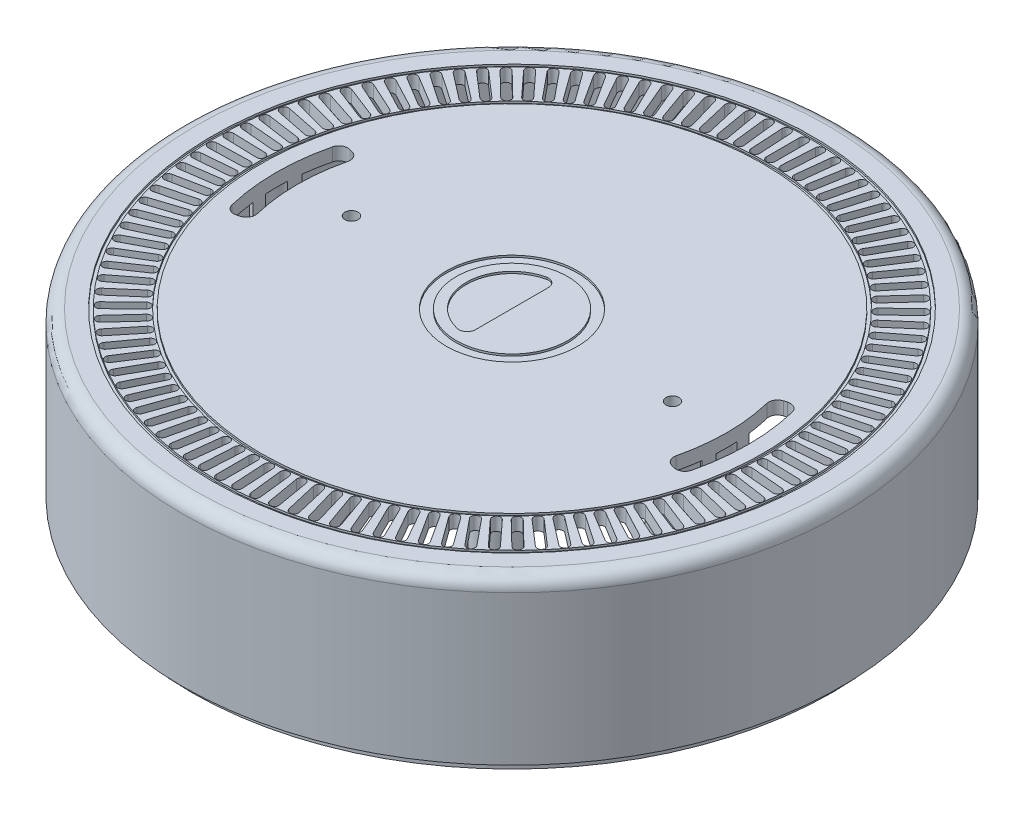
from build123d import *
from build123d.topology import SkipClean

# Parameters (mm, degrees)
SKETCH_1_R           = 50
EXTRUDE_1_DEPTH      = 4
SHELL_1_T            = -2
SKETCH_5_R           = 3
SKETCH_5_R_2         = 1.25
EXTRUDE_3_DEPTH      = 22.12
EXTRUDE_START        = -4
SKETCH_30_R          = 50.3
SKETCH_30_R_2        = 50
EXTRUDE_15_DEPTH     = 4
FILLET_3_R           = 2
CHAMFER_1_SIZE       = 0.3
EXTRUDE_START_2      = 28
SKETCH_38_R          = 50.3
SKETCH_38_R_2        = 48
EXTRUDE_21_DEPTH     = 28
SKETCH_44_R          = 50.3
SKETCH_44_R_2        = 48
CUT_EXTRUDE_6_DEPTH  = 5.7
CUT_EXTRUDE_7_DEPTH  = 2
SKETCH_35_R          = 45.7
SKETCH_35_R_2        = 45.2
SKETCH_35_R_3        = 38.8
SKETCH_35_R_4        = 38.3
CUT_EXTRUDE_9_DEPTH  = 0.3
SKETCH_46_R          = 1
CUT_EXTRUDE_10_DEPTH = 10
SKETCH_47_R          = 3
SKETCH_47_R_2        = 1
EXTRUDE_22_DEPTH     = 20.3
SKETCH_51_R          = 50.3
SKETCH_51_R_2        = 48.9
CUT_EXTRUDE_12_DEPTH = 1.5
SKETCH_57_R          = 1.25
EXTRUDE_23_DEPTH     = 13
SKETCH_34_R          = 10
SKETCH_34_R_2        = 8.490267481
CUT_EXTRUDE_14_DEPTH = 0.3
CUT_EXTRUDE_15_DEPTH = 3
EXTRUDE_24_DEPTH     = 10


with BuildPart() as part:
    # Эскиз1 → Бобышка-Вытянуть1 (new body)
    with BuildSketch(Plane(origin=(0, 0, 0), x_dir=(1, 0, 0), z_dir=(0, 1, 0))):
        with Locations(Location((0, 0, 0), (0, 0, 270))):
            Circle(SKETCH_1_R)
    extrude(amount=EXTRUDE_1_DEPTH)

    # Оболочка1
    shell_1_openings = [part.faces().sort_by_distance(p)[0] for p in [
        (0, 0, 0),
    ]]
    offset(amount=SHELL_1_T, openings=shell_1_openings, kind=Kind.INTERSECTION)

    # Эскиз5 → Бобышка-Вытянуть3 (add)
    # profile 1 of 4: a face of its own
    with BuildSketch(Plane.XZ.offset(-2)):
        with Locations(Location((-23.5, 26, 0), (0, 0, 90))):
            Circle(SKETCH_5_R)
        with Locations(Location((-23.5, 26, 0), (0, 0, 270))):
            Circle(SKETCH_5_R_2, mode=Mode.SUBTRACT)
    # profile 2 of 4: a face of its own
    with BuildSketch(Plane.XZ.offset(-2)):
        with Locations(Location((23.5, 26, 0), (0, 0, 90))):
            Circle(SKETCH_5_R)
        with Locations(Location((23.5, 26, 0), (0, 0, 270))):
            Circle(SKETCH_5_R_2, mode=Mode.SUBTRACT)
    # profile 3 of 4: a face of its own
    with BuildSketch(Plane.XZ.offset(-2)):
        with Locations(Location((23.5, -26, 0), (0, 0, 90))):
            Circle(SKETCH_5_R)
        with Locations(Location((23.5, -26, 0), (0, 0, 90))):
            Circle(SKETCH_5_R_2, mode=Mode.SUBTRACT)
    # profile 4 of 4: a face of its own
    with BuildSketch(Plane.XZ.offset(-2)):
        with Locations(Location((-23.5, -26, 0), (0, 0, 90))):
            Circle(SKETCH_5_R)
        with Locations(Location((-23.5, -26, 0), (0, 0, 90))):
            Circle(SKETCH_5_R_2, mode=Mode.SUBTRACT)
    extrude(amount=EXTRUDE_3_DEPTH)

    # Эскиз30 → Бобышка-Вытянуть15 (add)
    with BuildSketch(Plane(origin=(0, 4, 0), x_dir=(1, 0, 0), z_dir=(0, 1, 0)).offset(EXTRUDE_START)):
        with Locations(Location((0, 0, 0), (0, 0, 270))):
            Circle(SKETCH_30_R)
        Circle(SKETCH_30_R_2, mode=Mode.SUBTRACT)
    extrude(amount=EXTRUDE_15_DEPTH)

    # Скругление3
    fillet_3_edges = [part.edges().sort_by_distance(p)[0] for p in [
        (0, 4, -50.3),
    ]]
    fillet(fillet_3_edges, radius=FILLET_3_R)

    # Фаска1
    chamfer_1_edges = [part.edges().sort_by_distance(p)[0] for p in [
        (23.5, -20.12, -27.25),
        (23.5, -20.12, 27.25),
        (-23.5, -20.12, 27.25),
        (-23.5, -20.12, -27.25),
    ]]
    chamfer(chamfer_1_edges, length=CHAMFER_1_SIZE)

    # Эскиз38 → Бобышка-Вытянуть21 (add)
    with SkipClean():  # the faces are left unmerged after this step: merging them gives an invalid solid
        with BuildSketch(Plane.XZ.offset(EXTRUDE_START_2)):
            with Locations(Location((0, 0, 0), (0, 0, 90))):
                Circle(SKETCH_38_R)
            with Locations(Location((0, 0, 0), (0, 0, 270))):
                Circle(SKETCH_38_R_2, mode=Mode.SUBTRACT)
        extrude(amount=-EXTRUDE_21_DEPTH)

    # Эскиз44 → Вырез-Вытянуть6 (cut)
    with SkipClean():  # the faces are left unmerged after this step: merging them gives an invalid solid
        with BuildSketch(Plane.XZ.offset(28)):
            with Locations(Location((0, 0, 0), (0, 0, 90))):
                Circle(SKETCH_44_R)
            with Locations(Location((0, 0, 0), (0, 0, 270))):
                Circle(SKETCH_44_R_2, mode=Mode.SUBTRACT)
        extrude(amount=-CUT_EXTRUDE_6_DEPTH, mode=Mode.SUBTRACT)

    # Эскиз45 → Вырез-Вытянуть7 (cut)
    with SkipClean():  # the faces are left unmerged after this step: merging them gives an invalid solid
        with BuildSketch(Plane(origin=(0, 4, 0), x_dir=(1, 0, 0), z_dir=(0, 1, 0))):
            with BuildLine():
                Line((32.93809173, -8.535873533), (33.42119606, -8.665320948))
                ThreePointArc((33.42119606, -8.665320948), (34.459583784, -8.522270602), (35.082611767, -7.679330154))
                ThreePointArc((35.082611767, -7.679330154), (36, 0), (35.082611767, 7.679330154))
                ThreePointArc((35.082611767, 7.679330154), (34.459583784, 8.522270602), (33.42119606, 8.665320948))
                Line((33.42119606, 8.665320948), (32.93809173, 8.535873533))
                ThreePointArc((32.93809173, 8.535873533), (32.126682419, 7.921082261), (31.975363407, 6.914376775))
                ThreePointArc((31.975363407, 6.914376775), (32.8, 0), (31.975363407, -6.914376775))
                ThreePointArc((31.975363407, -6.914376775), (32.126682419, -7.921082261), (32.93809173, -8.535873533))
            make_face()
            with BuildLine():
                Line((-32.93809173, 8.535873533), (-33.42119606, 8.665320948))
                ThreePointArc((-33.42119606, 8.665320948), (-34.459583784, 8.522270602), (-35.082611767, 7.679330154))
                ThreePointArc((-35.082611767, 7.679330154), (-36, 0), (-35.082611767, -7.679330154))
                ThreePointArc((-35.082611767, -7.679330154), (-34.459583784, -8.522270602), (-33.42119606, -8.665320948))
                Line((-33.42119606, -8.665320948), (-32.93809173, -8.535873533))
                ThreePointArc((-32.93809173, -8.535873533), (-32.126682419, -7.921082261), (-31.975363407, -6.914376775))
                ThreePointArc((-31.975363407, -6.914376775), (-32.8, 0), (-31.975363407, 6.914376775))
                ThreePointArc((-31.975363407, 6.914376775), (-32.126682419, 7.921082261), (-32.93809173, 8.535873533))
            make_face()
        extrude(amount=-CUT_EXTRUDE_7_DEPTH, mode=Mode.SUBTRACT)

    # Эскиз35 → Вырез-Вытянуть9 (cut)
    # profile 1 of 2: a face of its own
    with SkipClean():  # the faces are left unmerged after this step: merging them gives an invalid solid
        with BuildSketch(Plane(origin=(0, 4, 0), x_dir=(1, 0, 0), z_dir=(0, 1, 0))):
            with Locations(Location((0, 0, 0), (0, 0, 270))):
                Circle(SKETCH_35_R)
            with Locations(Location((0, 0, 0), (0, 0, 270))):
                Circle(SKETCH_35_R_2, mode=Mode.SUBTRACT)
        # profile 2 of 2: a face of its own
        with BuildSketch(Plane(origin=(0, 4, 0), x_dir=(1, 0, 0), z_dir=(0, 1, 0))):
            with Locations(Location((0, 0, 0), (0, 0, 270))):
                Circle(SKETCH_35_R_3)
            with Locations(Location((0, 0, 0), (0, 0, 270))):
                Circle(SKETCH_35_R_4, mode=Mode.SUBTRACT)
        extrude(amount=-CUT_EXTRUDE_9_DEPTH, mode=Mode.SUBTRACT)

    # Эскиз46 → Вырез-Вытянуть10 (cut)
    with SkipClean():  # the faces are left unmerged after this step: merging them gives an invalid solid
        with BuildSketch(Plane(origin=(0, 4, 0), x_dir=(1, 0, 0), z_dir=(0, 1, 0))):
            with Locations(Location((24.5, 0, 0), (0, 0, 270))):
                Circle(SKETCH_46_R)
            with Locations(Location((-24.5, 0, 0), (0, 0, 270))):
                Circle(SKETCH_46_R)
        extrude(amount=-CUT_EXTRUDE_10_DEPTH, mode=Mode.SUBTRACT)

    # Эскиз47 → Бобышка-Вытянуть22 (add)
    # profile 1 of 2: a face of its own
    with SkipClean():  # the faces are left unmerged after this step: merging them gives an invalid solid
        with BuildSketch(Plane.XZ.offset(-2)):
            with Locations(Location((-24.5, 0, 0), (0, 0, 90))):
                Circle(SKETCH_47_R)
            with Locations(Location((-24.5, 0, 0), (0, 0, 270))):
                Circle(SKETCH_47_R_2, mode=Mode.SUBTRACT)
        # profile 2 of 2: a face of its own
        with BuildSketch(Plane.XZ.offset(-2)):
            with Locations(Location((24.5, 0, 0), (0, 0, 90))):
                Circle(SKETCH_47_R)
            with Locations(Location((24.5, 0, 0), (0, 0, 90))):
                Circle(SKETCH_47_R_2, mode=Mode.SUBTRACT)
        extrude(amount=EXTRUDE_22_DEPTH)

    # Эскиз51 → Вырез-Вытянуть12 (cut)
    with SkipClean():  # the faces are left unmerged after this step: merging them gives an invalid solid
        with BuildSketch(Plane.XZ.offset(22.3)):
            with Locations(Location((0, 0, 0), (0, 0, 90))):
                Circle(SKETCH_51_R)
            with Locations(Location((0, 0, 0), (0, 0, 270))):
                Circle(SKETCH_51_R_2, mode=Mode.SUBTRACT)
        extrude(amount=-CUT_EXTRUDE_12_DEPTH, mode=Mode.SUBTRACT)

    # Эскиз57 → Бобышка-Вытянуть23 (add)
    with SkipClean():  # the faces are left unmerged after this step: merging them gives an invalid solid
        with BuildSketch(Plane.XZ.offset(-2)):
            with Locations(Location((-23.5, 26, 0), (0, 0, 270))):
                Circle(SKETCH_57_R)
            with Locations(Location((-23.5, -26, 0), (0, 0, 90))):
                Circle(SKETCH_57_R)
            with Locations(Location((23.5, -26, 0), (0, 0, 90))):
                Circle(SKETCH_57_R)
            with Locations(Location((23.5, 26, 0), (0, 0, 270))):
                Circle(SKETCH_57_R)
        extrude(amount=EXTRUDE_23_DEPTH)

    # Эскиз34 → Вырез-Вытянуть14 (cut)
    # profile 1 of 2: a face of its own
    with SkipClean():  # the faces are left unmerged after this step: merging them gives an invalid solid
        with BuildSketch(Plane(origin=(0, 4, 0), x_dir=(1, 0, 0), z_dir=(0, 1, 0))):
            with Locations(Location((0, 0, 0), (0, 0, 270))):
                Circle(SKETCH_34_R)
            with Locations(Location((0, 0, 0), (0, 0, 270))):
                Circle(SKETCH_34_R_2, mode=Mode.SUBTRACT)
        # profile 2 of 2: a face of its own
        with BuildSketch(Plane(origin=(0, 4, 0), x_dir=(1, 0, 0), z_dir=(0, 1, 0))):
            with BuildLine():
                ThreePointArc((0, -5.565646409), (-0.474742908, -6.552289655), (-1.5419684, -6.796984316))
                ThreePointArc((-1.5419684, -6.796984316), (-6.969696, 0), (-1.5419684, 6.796984316))
                ThreePointArc((-1.5419684, 6.796984316), (-0.474742908, 6.552289655), (0, 5.565646409))
                Line((0, 5.565646409), (0, -5.565646409))
            make_face()
        extrude(amount=-CUT_EXTRUDE_14_DEPTH, mode=Mode.SUBTRACT)

    # Эскиз60 → Вырез-Вытянуть15 (cut)
    with SkipClean():  # the faces are left unmerged after this step: merging them gives an invalid solid
        with BuildSketch(Plane(origin=(0, 4, 0), x_dir=(1, 0, 0), z_dir=(0, 1, 0))):
            with BuildLine():
                Line((0.65, 44.480332068), (0.65, 39.480332068))
                ThreePointArc((0.65, 39.480332068), (0, 38.830332068), (-0.65, 39.480332068))
                Line((-0.65, 39.480332068), (-0.65, 44.480332068))
                ThreePointArc((-0.65, 44.480332068), (0, 45.130332068), (0.65, 44.480332068))
            make_face()
            with BuildLine():
                Line((3.188269182, 44.370681542), (2.902825128, 39.378836022))
                ThreePointArc((2.902825128, 39.378836022), (2.216777483, 38.767003831), (1.604945293, 39.453051476))
                Line((1.604945293, 39.453051476), (1.890389347, 44.444896996))
                ThreePointArc((1.890389347, 44.444896996), (2.576436992, 45.056729186), (3.188269182, 44.370681542))
            make_face()
            with BuildLine():
                Line((5.716138893, 44.116303075), (5.146181843, 39.148894398))
                ThreePointArc((5.146181843, 39.148894398), (4.426324299, 38.577225687), (3.854655587, 39.297083231))
                Line((3.854655587, 39.297083231), (4.424612637, 44.264491908))
                ThreePointArc((4.424612637, 44.264491908), (5.144470181, 44.836160619), (5.716138893, 44.116303075))
            make_face()
            with BuildLine():
                Line((8.225363746, 43.718026397), (7.372752783, 38.791257218))
                ThreePointArc((7.372752783, 38.791257218), (6.621433365, 38.26161665), (6.091792797, 39.012936069))
                Line((6.091792797, 39.012936069), (6.94440376, 43.939705248))
                ThreePointArc((6.94440376, 43.939705248), (7.695723178, 44.469345816), (8.225363746, 43.718026397))
            make_face()
            with BuildLine():
                Line((10.707759173, 43.177150605), (9.575275336, 38.30709102))
                ThreePointArc((9.575275336, 38.30709102), (8.794944691, 37.821206173), (8.309059844, 38.601536817))
                Line((8.309059844, 38.601536817), (9.441543681, 43.471596402))
                ThreePointArc((9.441543681, 43.471596402), (10.221874326, 43.957481249), (10.707759173, 43.177150605))
            make_face()
            with BuildLine():
                Line((13.155228115, 42.495439921), (11.746565331, 37.697975053))
                ThreePointArc((11.746565331, 37.697975053), (10.939768736, 37.257430782), (10.499224465, 38.064227377))
                Line((10.499224465, 38.064227377), (11.90788725, 42.861692245))
                ThreePointArc((11.90788725, 42.861692245), (12.714683844, 43.302236516), (13.155228115, 42.495439921))
            make_face()
            with BuildLine():
                Line((15.559787438, 41.675117945), (13.879540472, 36.965896127))
                ThreePointArc((13.879540472, 36.965896127), (13.04890953, 36.572129396), (12.655142799, 37.402760338))
                Line((12.655142799, 37.402760338), (14.335389765, 42.111982156))
                ThreePointArc((14.335389765, 42.111982156), (15.166020707, 42.505748887), (15.559787438, 41.675117945))
            make_face()
            with BuildLine():
                Line((17.913593967, 40.718860397), (15.967243436, 36.113242131))
                ThreePointArc((15.967243436, 36.113242131), (15.115487492, 35.767537326), (14.769782687, 36.619293269))
                Line((14.769782687, 36.619293269), (16.716133218, 41.224911535))
                ThreePointArc((16.716133218, 41.224911535), (17.567889162, 41.57061634), (17.913593967, 40.718860397))
            make_face()
            with BuildLine():
                Line((20.208970077, 39.629786389), (18.002864571, 35.142794246))
                ThreePointArc((18.002864571, 35.142794246), (17.132761876, 34.846278983), (16.836246614, 35.716381677))
                Line((16.836246614, 35.716381677), (19.04235212, 40.203373821))
                ThreePointArc((19.04235212, 40.203373821), (19.912454814, 40.499889084), (20.208970077, 39.629786389))
            make_face()
            with BuildLine():
                Line((22.438428727, 38.411448256), (19.979764104, 34.05771787))
                ThreePointArc((19.979764104, 34.05771787), (19.094152753, 33.811359321), (18.847794203, 34.696970672))
                Line((18.847794203, 34.696970672), (21.306458827, 39.050701058))
                ThreePointArc((21.306458827, 39.050701058), (22.192070178, 39.297059607), (22.438428727, 38.411448256))
            make_face()
            with BuildLine():
                Line((24.594697886, 37.067819962), (21.891493799, 32.861552298))
                ThreePointArc((21.891493799, 32.861552298), (20.993262471, 32.666154033), (20.797864206, 33.564385361))
                Line((20.797864206, 33.564385361), (23.501068293, 37.770653025))
                ThreePointArc((23.501068293, 37.770653025), (24.399299621, 37.96605129), (24.594697886, 37.067819962))
            make_face()
            with BuildLine():
                Line((26.670744253, 35.603284144), (23.731817991, 31.558199172))
                ThreePointArc((23.731817991, 31.558199172), (22.823896531, 31.41439854), (22.680095899, 32.32232))
                Line((22.680095899, 32.32232), (25.61902216, 36.367404972))
                ThreePointArc((25.61902216, 36.367404972), (26.52694362, 36.511205604), (26.670744253, 35.603284144))
            make_face()
            with BuildLine():
                Line((28.659796195, 34.022617814), (25.494733926, 30.15190976))
                ThreePointArc((25.494733926, 30.15190976), (24.580083784, 30.060175808), (24.488349832, 30.97482595))
                Line((24.488349832, 30.97482595), (27.653412101, 34.845534004))
                ThreePointArc((27.653412101, 34.845534004), (28.568062243, 34.937267955), (28.659796195, 34.022617814))
            make_face()
            with BuildLine():
                Line((30.55536584, 32.330976775), (27.174491338, 28.647271086))
                ThreePointArc((27.174491338, 28.647271086), (26.256095913, 28.607903032), (26.216727859, 29.526298456))
                Line((26.216727859, 29.526298456), (29.59760236, 33.210004146))
                ThreePointArc((29.59760236, 33.210004146), (30.515997785, 33.2493722), (30.55536584, 32.330976775))
            make_face()
            with BuildLine():
                Line((32.351270232, 30.533878811), (28.765611208, 27.049190968))
                ThreePointArc((28.765611208, 27.049190968), (27.846466115, 27.062317221), (27.859592368, 27.981462314))
                Line((27.859592368, 27.981462314), (31.445251392, 31.466150157))
                ThreePointArc((31.445251392, 31.466150157), (32.364396485, 31.453023904), (32.351270232, 30.533878811))
            make_face()
            with BuildLine():
                Line((34.041651504, 28.637185681), (30.262903632, 25.362882011))
                ThreePointArc((30.262903632, 25.362882011), (29.346006932, 25.428459757), (29.411584678, 26.345356457))
                Line((29.411584678, 26.345356457), (33.19033255, 29.619660127))
                ThreePointArc((33.19033255, 29.619660127), (34.107229251, 29.554082381), (34.041651504, 28.637185681))
            make_face()
            with BuildLine():
                Line((35.620995985, 26.647084003), (31.661484756, 23.593844605))
                ThreePointArc((31.661484756, 23.593844605), (30.749827174, 23.711659943), (30.867642512, 24.623317524))
                Line((30.867642512, 24.623317524), (34.827153742, 27.676556922))
                ThreePointArc((34.827153742, 27.676556922), (35.738811324, 27.558741584), (35.620995985, 26.647084003))
            make_face()
            with BuildLine():
                Line((37.084152182, 24.570065075), (32.956792697, 21.747848981))
                ThreePointArc((32.956792697, 21.747848981), (32.053347872, 21.917517622), (32.223016512, 22.820962447))
                Line((32.223016512, 22.820962447), (36.350375997, 25.643178542))
                ThreePointArc((36.350375997, 25.643178542), (37.253820822, 25.473509901), (37.084152182, 24.570065075))
            make_face()
            with BuildLine():
                Line((38.426347581, 22.412903703), (34.14460243, 19.830916395))
                ThreePointArc((34.14460243, 19.830916395), (33.25231721, 20.051884914), (33.47328573, 20.944170134))
                Line((33.47328573, 20.944170134), (37.755030881, 23.526157442))
                ThreePointArc((37.755030881, 23.526157442), (38.647316101, 23.305188923), (38.426347581, 22.412903703))
            make_face()
            with BuildLine():
                Line((39.643204222, 20.182636097), (35.221039567, 17.849299481))
                ThreePointArc((35.221039567, 17.849299481), (34.342824402, 18.120847126), (34.614372047, 18.999062291))
                Line((34.614372047, 18.999062291), (39.036536702, 21.332398907))
                ThreePointArc((39.036536702, 21.332398907), (39.914751867, 21.060851262), (39.643204222, 20.182636097))
            make_face()
            with BuildLine():
                Line((40.730752971, 17.886536927), (36.182592994, 15.809461862))
                ThreePointArc((36.182592994, 15.809461862), (35.321312439, 16.130702901), (35.642553477, 16.991983456))
                Line((35.642553477, 16.991983456), (40.190713454, 19.069058521))
                ThreePointArc((40.190713454, 19.069058521), (41.05199401, 18.747817483), (40.730752971, 17.886536927))
            make_face()
            with BuildLine():
                Line((41.68544647, 15.532095592), (37.026126324, 13.718057065))
                ThreePointArc((37.026126324, 13.718057065), (36.184589696, 14.087943675), (36.554476307, 14.929480303))
                Line((36.554476307, 14.929480303), (41.213796453, 16.74351883))
                ThreePointArc((41.213796453, 16.74351883), (42.05533308, 16.373632219), (41.68544647, 15.532095592))
            make_face()
            with BuildLine():
                Line((42.504170706, 13.126991789), (37.748888125, 11.581906817))
                ThreePointArc((37.748888125, 11.581906817), (36.929840343, 11.999232506), (37.347166032, 12.818280288))
                Line((37.347166032, 12.818280288), (42.102448613, 14.36336526))
                ThreePointArc((42.102448613, 14.36336526), (42.921496395, 13.946039571), (42.504170706, 13.126991789))
            make_face()
            with BuildLine():
                Line((43.184255172, 10.679070467), (38.348520899, 9.407978796))
                ThreePointArc((38.348520899, 9.407978796), (37.554633526, 9.871382334), (38.018037065, 10.665269707))
                Line((38.018037065, 10.665269707), (42.853771338, 11.936361378))
                ThreePointArc((42.853771338, 11.936361378), (43.647658711, 11.47295784), (43.184255172, 10.679070467))
            make_face()
            with BuildLine():
                Line((43.723481574, 8.196316237), (38.823068769, 7.203363904))
                ThreePointArc((38.823068769, 7.203363904), (38.056931301, 7.711333765), (38.564901162, 8.477471233))
                Line((38.564901162, 8.477471233), (43.465313968, 9.470423567))
                ThreePointArc((43.465313968, 9.470423567), (44.231451436, 8.962453705), (43.723481574, 8.196316237))
            make_face()
            with BuildLine():
                Line((44.120091067, 5.686827327), (39.170983858, 4.975253136))
                ThreePointArc((39.170983858, 4.975253136), (38.435095276, 5.526132428), (38.985974568, 6.26202101))
                Line((38.985974568, 6.26202101), (43.935081778, 6.973595202))
                ThreePointArc((43.935081778, 6.973595202), (44.67097036, 6.422715909), (44.120091067, 5.686827327))
            make_face()
            with BuildLine():
                Line((44.372789994, 3.158789169), (39.391131339, 2.730914126))
                ThreePointArc((39.391131339, 2.730914126), (38.687891959, 3.322905996), (39.279883828, 4.026145376))
                Line((39.279883828, 4.026145376), (44.261542483, 4.454020419))
                ThreePointArc((44.261542483, 4.454020419), (44.964781863, 3.862028549), (44.372789994, 3.158789169))
            make_face()
            with BuildLine():
                Line((44.480754102, 0.620447697), (39.482793138, 0.477667443))
                ThreePointArc((39.482793138, 0.477667443), (38.81449678, 1.108840935), (39.445670272, 1.777137293))
                Line((39.445670272, 1.777137293), (44.443631236, 1.919917547))
                ThreePointArc((44.443631236, 1.919917547), (45.111927594, 1.288744055), (44.480754102, 0.620447697))
            make_face()
            with BuildLine():
                Line((44.443631236, -1.919917547), (39.445670272, -1.777137293))
                ThreePointArc((39.445670272, -1.777137293), (38.81449678, -1.108840935), (39.482793138, -0.477667443))
                Line((39.482793138, -0.477667443), (44.480754102, -0.620447697))
                ThreePointArc((44.480754102, -0.620447697), (45.111927594, -1.288744055), (44.443631236, -1.919917547))
            make_face()
            with BuildLine():
                Line((44.261542483, -4.454020419), (39.279883828, -4.026145376))
                ThreePointArc((39.279883828, -4.026145376), (38.687891959, -3.322905996), (39.391131339, -2.730914126))
                Line((39.391131339, -2.730914126), (44.372789994, -3.158789169))
                ThreePointArc((44.372789994, -3.158789169), (44.964781863, -3.862028549), (44.261542483, -4.454020419))
            make_face()
            with BuildLine():
                Line((43.935081778, -6.973595202), (38.985974568, -6.26202101))
                ThreePointArc((38.985974568, -6.26202101), (38.435095276, -5.526132428), (39.170983858, -4.975253136))
                Line((39.170983858, -4.975253136), (44.120091067, -5.686827327))
                ThreePointArc((44.120091067, -5.686827327), (44.67097036, -6.422715909), (43.935081778, -6.973595202))
            make_face()
            with BuildLine():
                Line((43.465313968, -9.470423567), (38.564901162, -8.477471233))
                ThreePointArc((38.564901162, -8.477471233), (38.056931301, -7.711333765), (38.823068769, -7.203363904))
                Line((38.823068769, -7.203363904), (43.723481574, -8.196316237))
                ThreePointArc((43.723481574, -8.196316237), (44.231451436, -8.962453705), (43.465313968, -9.470423567))
            make_face()
            with BuildLine():
                Line((42.853771338, -11.936361378), (38.018037065, -10.665269707))
                ThreePointArc((38.018037065, -10.665269707), (37.554633526, -9.871382334), (38.348520899, -9.407978796))
                Line((38.348520899, -9.407978796), (43.184255172, -10.679070467))
                ThreePointArc((43.184255172, -10.679070467), (43.647658711, -11.47295784), (42.853771338, -11.936361378))
            make_face()
            with BuildLine():
                Line((42.102448613, -14.36336526), (37.347166032, -12.818280288))
                ThreePointArc((37.347166032, -12.818280288), (36.929840343, -11.999232506), (37.748888125, -11.581906817))
                Line((37.748888125, -11.581906817), (42.504170706, -13.126991789))
                ThreePointArc((42.504170706, -13.126991789), (42.921496395, -13.946039571), (42.102448613, -14.36336526))
            make_face()
            with BuildLine():
                Line((41.213796453, -16.74351883), (36.554476307, -14.929480303))
                ThreePointArc((36.554476307, -14.929480303), (36.184589696, -14.087943675), (37.026126324, -13.718057065))
                Line((37.026126324, -13.718057065), (41.68544647, -15.532095592))
                ThreePointArc((41.68544647, -15.532095592), (42.05533308, -16.373632219), (41.213796453, -16.74351883))
            make_face()
            with BuildLine():
                Line((40.190713454, -19.069058521), (35.642553477, -16.991983456))
                ThreePointArc((35.642553477, -16.991983456), (35.321312439, -16.130702901), (36.182592994, -15.809461862))
                Line((36.182592994, -15.809461862), (40.730752971, -17.886536927))
                ThreePointArc((40.730752971, -17.886536927), (41.05199401, -18.747817483), (40.190713454, -19.069058521))
            make_face()
            with BuildLine():
                Line((39.036536702, -21.332398907), (34.614372047, -18.999062291))
                ThreePointArc((34.614372047, -18.999062291), (34.342824402, -18.120847126), (35.221039567, -17.849299481))
                Line((35.221039567, -17.849299481), (39.643204222, -20.182636097))
                ThreePointArc((39.643204222, -20.182636097), (39.914751867, -21.060851262), (39.036536702, -21.332398907))
            make_face()
            with BuildLine():
                Line((37.755030881, -23.526157442), (33.47328573, -20.944170134))
                ThreePointArc((33.47328573, -20.944170134), (33.25231721, -20.051884914), (34.14460243, -19.830916395))
                Line((34.14460243, -19.830916395), (38.426347581, -22.412903703))
                ThreePointArc((38.426347581, -22.412903703), (38.647316101, -23.305188923), (37.755030881, -23.526157442))
            make_face()
            with BuildLine():
                Line((36.350375997, -25.643178542), (32.223016512, -22.820962447))
                ThreePointArc((32.223016512, -22.820962447), (32.053347872, -21.917517622), (32.956792697, -21.747848981))
                Line((32.956792697, -21.747848981), (37.084152182, -24.570065075))
                ThreePointArc((37.084152182, -24.570065075), (37.253820822, -25.473509901), (36.350375997, -25.643178542))
            make_face()
            with BuildLine():
                Line((34.827153742, -27.676556922), (30.867642512, -24.623317524))
                ThreePointArc((30.867642512, -24.623317524), (30.749827174, -23.711659943), (31.661484756, -23.593844605))
                Line((31.661484756, -23.593844605), (35.620995985, -26.647084003))
                ThreePointArc((35.620995985, -26.647084003), (35.738811324, -27.558741584), (34.827153742, -27.676556922))
            make_face()
            with BuildLine():
                Line((33.19033255, -29.619660127), (29.411584678, -26.345356457))
                ThreePointArc((29.411584678, -26.345356457), (29.346006932, -25.428459757), (30.262903632, -25.362882011))
                Line((30.262903632, -25.362882011), (34.041651504, -28.637185681))
                ThreePointArc((34.041651504, -28.637185681), (34.107229251, -29.554082381), (33.19033255, -29.619660127))
            make_face()
            with BuildLine():
                Line((31.445251392, -31.466150157), (27.859592368, -27.981462314))
                ThreePointArc((27.859592368, -27.981462314), (27.846466115, -27.062317221), (28.765611208, -27.049190968))
                Line((28.765611208, -27.049190968), (32.351270232, -30.533878811))
                ThreePointArc((32.351270232, -30.533878811), (32.364396485, -31.453023904), (31.445251392, -31.466150157))
            make_face()
            with BuildLine():
                Line((29.59760236, -33.210004146), (26.216727859, -29.526298456))
                ThreePointArc((26.216727859, -29.526298456), (26.256095913, -28.607903032), (27.174491338, -28.647271086))
                Line((27.174491338, -28.647271086), (30.55536584, -32.330976775))
                ThreePointArc((30.55536584, -32.330976775), (30.515997785, -33.2493722), (29.59760236, -33.210004146))
            make_face()
            with BuildLine():
                Line((27.653412101, -34.845534004), (24.488349832, -30.97482595))
                ThreePointArc((24.488349832, -30.97482595), (24.580083784, -30.060175808), (25.494733926, -30.15190976))
                Line((25.494733926, -30.15190976), (28.659796195, -34.022617814))
                ThreePointArc((28.659796195, -34.022617814), (28.568062243, -34.937267955), (27.653412101, -34.845534004))
            make_face()
            with BuildLine():
                Line((25.61902216, -36.367404972), (22.680095899, -32.32232))
                ThreePointArc((22.680095899, -32.32232), (22.823896531, -31.41439854), (23.731817991, -31.558199172))
                Line((23.731817991, -31.558199172), (26.670744253, -35.603284144))
                ThreePointArc((26.670744253, -35.603284144), (26.52694362, -36.511205604), (25.61902216, -36.367404972))
            make_face()
            with BuildLine():
                Line((23.501068293, -37.770653025), (20.797864206, -33.564385361))
                ThreePointArc((20.797864206, -33.564385361), (20.993262471, -32.666154033), (21.891493799, -32.861552298))
                Line((21.891493799, -32.861552298), (24.594697886, -37.067819962))
                ThreePointArc((24.594697886, -37.067819962), (24.399299621, -37.96605129), (23.501068293, -37.770653025))
            make_face()
            with BuildLine():
                Line((21.306458827, -39.050701058), (18.847794203, -34.696970672))
                ThreePointArc((18.847794203, -34.696970672), (19.094152753, -33.811359321), (19.979764104, -34.05771787))
                Line((19.979764104, -34.05771787), (22.438428727, -38.411448256))
                ThreePointArc((22.438428727, -38.411448256), (22.192070178, -39.297059607), (21.306458827, -39.050701058))
            make_face()
            with BuildLine():
                Line((19.04235212, -40.203373821), (16.836246614, -35.716381677))
                ThreePointArc((16.836246614, -35.716381677), (17.132761876, -34.846278983), (18.002864571, -35.142794246))
                Line((18.002864571, -35.142794246), (20.208970077, -39.629786389))
                ThreePointArc((20.208970077, -39.629786389), (19.912454814, -40.499889084), (19.04235212, -40.203373821))
            make_face()
            with BuildLine():
                Line((16.716133218, -41.224911535), (14.769782687, -36.619293269))
                ThreePointArc((14.769782687, -36.619293269), (15.115487492, -35.767537326), (15.967243436, -36.113242131))
                Line((15.967243436, -36.113242131), (17.913593967, -40.718860397))
                ThreePointArc((17.913593967, -40.718860397), (17.567889162, -41.57061634), (16.716133218, -41.224911535))
            make_face()
            with BuildLine():
                Line((14.335389765, -42.111982156), (12.655142799, -37.402760338))
                ThreePointArc((12.655142799, -37.402760338), (13.04890953, -36.572129396), (13.879540472, -36.965896127))
                Line((13.879540472, -36.965896127), (15.559787438, -41.675117945))
                ThreePointArc((15.559787438, -41.675117945), (15.166020707, -42.505748887), (14.335389765, -42.111982156))
            make_face()
            with BuildLine():
                Line((11.90788725, -42.861692245), (10.499224465, -38.064227377))
                ThreePointArc((10.499224465, -38.064227377), (10.939768736, -37.257430782), (11.746565331, -37.697975053))
                Line((11.746565331, -37.697975053), (13.155228115, -42.495439921))
                ThreePointArc((13.155228115, -42.495439921), (12.714683844, -43.302236516), (11.90788725, -42.861692245))
            make_face()
            with BuildLine():
                Line((9.441543681, -43.471596402), (8.309059844, -38.601536817))
                ThreePointArc((8.309059844, -38.601536817), (8.794944691, -37.821206173), (9.575275336, -38.30709102))
                Line((9.575275336, -38.30709102), (10.707759173, -43.177150605))
                ThreePointArc((10.707759173, -43.177150605), (10.221874326, -43.957481249), (9.441543681, -43.471596402))
            make_face()
            with BuildLine():
                Line((6.94440376, -43.939705248), (6.091792797, -39.012936069))
                ThreePointArc((6.091792797, -39.012936069), (6.621433365, -38.26161665), (7.372752783, -38.791257218))
                Line((7.372752783, -38.791257218), (8.225363746, -43.718026397))
                ThreePointArc((8.225363746, -43.718026397), (7.695723178, -44.469345816), (6.94440376, -43.939705248))
            make_face()
            with BuildLine():
                Line((4.424612637, -44.264491908), (3.854655587, -39.297083231))
                ThreePointArc((3.854655587, -39.297083231), (4.426324299, -38.577225687), (5.146181843, -39.148894398))
                Line((5.146181843, -39.148894398), (5.716138893, -44.116303075))
                ThreePointArc((5.716138893, -44.116303075), (5.144470181, -44.836160619), (4.424612637, -44.264491908))
            make_face()
            with BuildLine():
                Line((1.890389347, -44.444896996), (1.604945293, -39.453051476))
                ThreePointArc((1.604945293, -39.453051476), (2.216777483, -38.767003831), (2.902825128, -39.378836022))
                Line((2.902825128, -39.378836022), (3.188269182, -44.370681542))
                ThreePointArc((3.188269182, -44.370681542), (2.576436992, -45.056729186), (1.890389347, -44.444896996))
            make_face()
            with BuildLine():
                Line((-0.65, -44.480332068), (-0.65, -39.480332068))
                ThreePointArc((-0.65, -39.480332068), (0, -38.830332068), (0.65, -39.480332068))
                Line((0.65, -39.480332068), (0.65, -44.480332068))
                ThreePointArc((0.65, -44.480332068), (0, -45.130332068), (-0.65, -44.480332068))
            make_face()
            with BuildLine():
                Line((-3.188269182, -44.370681542), (-2.902825128, -39.378836022))
                ThreePointArc((-2.902825128, -39.378836022), (-2.216777483, -38.767003831), (-1.604945293, -39.453051476))
                Line((-1.604945293, -39.453051476), (-1.890389347, -44.444896996))
                ThreePointArc((-1.890389347, -44.444896996), (-2.576436992, -45.056729186), (-3.188269182, -44.370681542))
            make_face()
            with BuildLine():
                Line((-5.716138893, -44.116303075), (-5.146181843, -39.148894398))
                ThreePointArc((-5.146181843, -39.148894398), (-4.426324299, -38.577225687), (-3.854655587, -39.297083231))
                Line((-3.854655587, -39.297083231), (-4.424612637, -44.264491908))
                ThreePointArc((-4.424612637, -44.264491908), (-5.144470181, -44.836160619), (-5.716138893, -44.116303075))
            make_face()
            with BuildLine():
                Line((-8.225363746, -43.718026397), (-7.372752783, -38.791257218))
                ThreePointArc((-7.372752783, -38.791257218), (-6.621433365, -38.26161665), (-6.091792797, -39.012936069))
                Line((-6.091792797, -39.012936069), (-6.94440376, -43.939705248))
                ThreePointArc((-6.94440376, -43.939705248), (-7.695723178, -44.469345816), (-8.225363746, -43.718026397))
            make_face()
            with BuildLine():
                Line((-10.707759173, -43.177150605), (-9.575275336, -38.30709102))
                ThreePointArc((-9.575275336, -38.30709102), (-8.794944691, -37.821206173), (-8.309059844, -38.601536817))
                Line((-8.309059844, -38.601536817), (-9.441543681, -43.471596402))
                ThreePointArc((-9.441543681, -43.471596402), (-10.221874326, -43.957481249), (-10.707759173, -43.177150605))
            make_face()
            with BuildLine():
                Line((-13.155228115, -42.495439921), (-11.746565331, -37.697975053))
                ThreePointArc((-11.746565331, -37.697975053), (-10.939768736, -37.257430782), (-10.499224465, -38.064227377))
                Line((-10.499224465, -38.064227377), (-11.90788725, -42.861692245))
                ThreePointArc((-11.90788725, -42.861692245), (-12.714683844, -43.302236516), (-13.155228115, -42.495439921))
            make_face()
            with BuildLine():
                Line((-15.559787438, -41.675117945), (-13.879540472, -36.965896127))
                ThreePointArc((-13.879540472, -36.965896127), (-13.04890953, -36.572129396), (-12.655142799, -37.402760338))
                Line((-12.655142799, -37.402760338), (-14.335389765, -42.111982156))
                ThreePointArc((-14.335389765, -42.111982156), (-15.166020707, -42.505748887), (-15.559787438, -41.675117945))
            make_face()
            with BuildLine():
                Line((-17.913593967, -40.718860397), (-15.967243436, -36.113242131))
                ThreePointArc((-15.967243436, -36.113242131), (-15.115487492, -35.767537326), (-14.769782687, -36.619293269))
                Line((-14.769782687, -36.619293269), (-16.716133218, -41.224911535))
                ThreePointArc((-16.716133218, -41.224911535), (-17.567889162, -41.57061634), (-17.913593967, -40.718860397))
            make_face()
            with BuildLine():
                Line((-20.208970077, -39.629786389), (-18.002864571, -35.142794246))
                ThreePointArc((-18.002864571, -35.142794246), (-17.132761876, -34.846278983), (-16.836246614, -35.716381677))
                Line((-16.836246614, -35.716381677), (-19.04235212, -40.203373821))
                ThreePointArc((-19.04235212, -40.203373821), (-19.912454814, -40.499889084), (-20.208970077, -39.629786389))
            make_face()
            with BuildLine():
                Line((-22.438428727, -38.411448256), (-19.979764104, -34.05771787))
                ThreePointArc((-19.979764104, -34.05771787), (-19.094152753, -33.811359321), (-18.847794203, -34.696970672))
                Line((-18.847794203, -34.696970672), (-21.306458827, -39.050701058))
                ThreePointArc((-21.306458827, -39.050701058), (-22.192070178, -39.297059607), (-22.438428727, -38.411448256))
            make_face()
            with BuildLine():
                Line((-24.594697886, -37.067819962), (-21.891493799, -32.861552298))
                ThreePointArc((-21.891493799, -32.861552298), (-20.993262471, -32.666154033), (-20.797864206, -33.564385361))
                Line((-20.797864206, -33.564385361), (-23.501068293, -37.770653025))
                ThreePointArc((-23.501068293, -37.770653025), (-24.399299621, -37.96605129), (-24.594697886, -37.067819962))
            make_face()
            with BuildLine():
                Line((-26.670744253, -35.603284144), (-23.731817991, -31.558199172))
                ThreePointArc((-23.731817991, -31.558199172), (-22.823896531, -31.41439854), (-22.680095899, -32.32232))
                Line((-22.680095899, -32.32232), (-25.61902216, -36.367404972))
                ThreePointArc((-25.61902216, -36.367404972), (-26.52694362, -36.511205604), (-26.670744253, -35.603284144))
            make_face()
            with BuildLine():
                Line((-28.659796195, -34.022617814), (-25.494733926, -30.15190976))
                ThreePointArc((-25.494733926, -30.15190976), (-24.580083784, -30.060175808), (-24.488349832, -30.97482595))
                Line((-24.488349832, -30.97482595), (-27.653412101, -34.845534004))
                ThreePointArc((-27.653412101, -34.845534004), (-28.568062243, -34.937267955), (-28.659796195, -34.022617814))
            make_face()
            with BuildLine():
                Line((-30.55536584, -32.330976775), (-27.174491338, -28.647271086))
                ThreePointArc((-27.174491338, -28.647271086), (-26.256095913, -28.607903032), (-26.216727859, -29.526298456))
                Line((-26.216727859, -29.526298456), (-29.59760236, -33.210004146))
                ThreePointArc((-29.59760236, -33.210004146), (-30.515997785, -33.2493722), (-30.55536584, -32.330976775))
            make_face()
            with BuildLine():
                Line((-32.351270232, -30.533878811), (-28.765611208, -27.049190968))
                ThreePointArc((-28.765611208, -27.049190968), (-27.846466115, -27.062317221), (-27.859592368, -27.981462314))
                Line((-27.859592368, -27.981462314), (-31.445251392, -31.466150157))
                ThreePointArc((-31.445251392, -31.466150157), (-32.364396485, -31.453023904), (-32.351270232, -30.533878811))
            make_face()
            with BuildLine():
                Line((-34.041651504, -28.637185681), (-30.262903632, -25.362882011))
                ThreePointArc((-30.262903632, -25.362882011), (-29.346006932, -25.428459757), (-29.411584678, -26.345356457))
                Line((-29.411584678, -26.345356457), (-33.19033255, -29.619660127))
                ThreePointArc((-33.19033255, -29.619660127), (-34.107229251, -29.554082381), (-34.041651504, -28.637185681))
            make_face()
            with BuildLine():
                Line((-35.620995985, -26.647084003), (-31.661484756, -23.593844605))
                ThreePointArc((-31.661484756, -23.593844605), (-30.749827174, -23.711659943), (-30.867642512, -24.623317524))
                Line((-30.867642512, -24.623317524), (-34.827153742, -27.676556922))
                ThreePointArc((-34.827153742, -27.676556922), (-35.738811324, -27.558741584), (-35.620995985, -26.647084003))
            make_face()
            with BuildLine():
                Line((-37.084152182, -24.570065075), (-32.956792697, -21.747848981))
                ThreePointArc((-32.956792697, -21.747848981), (-32.053347872, -21.917517622), (-32.223016512, -22.820962447))
                Line((-32.223016512, -22.820962447), (-36.350375997, -25.643178542))
                ThreePointArc((-36.350375997, -25.643178542), (-37.253820822, -25.473509901), (-37.084152182, -24.570065075))
            make_face()
            with BuildLine():
                Line((-38.426347581, -22.412903703), (-34.14460243, -19.830916395))
                ThreePointArc((-34.14460243, -19.830916395), (-33.25231721, -20.051884914), (-33.47328573, -20.944170134))
                Line((-33.47328573, -20.944170134), (-37.755030881, -23.526157442))
                ThreePointArc((-37.755030881, -23.526157442), (-38.647316101, -23.305188923), (-38.426347581, -22.412903703))
            make_face()
            with BuildLine():
                Line((-39.643204222, -20.182636097), (-35.221039567, -17.849299481))
                ThreePointArc((-35.221039567, -17.849299481), (-34.342824402, -18.120847126), (-34.614372047, -18.999062291))
                Line((-34.614372047, -18.999062291), (-39.036536702, -21.332398907))
                ThreePointArc((-39.036536702, -21.332398907), (-39.914751867, -21.060851262), (-39.643204222, -20.182636097))
            make_face()
            with BuildLine():
                Line((-40.730752971, -17.886536927), (-36.182592994, -15.809461862))
                ThreePointArc((-36.182592994, -15.809461862), (-35.321312439, -16.130702901), (-35.642553477, -16.991983456))
                Line((-35.642553477, -16.991983456), (-40.190713454, -19.069058521))
                ThreePointArc((-40.190713454, -19.069058521), (-41.05199401, -18.747817483), (-40.730752971, -17.886536927))
            make_face()
            with BuildLine():
                Line((-41.68544647, -15.532095592), (-37.026126324, -13.718057065))
                ThreePointArc((-37.026126324, -13.718057065), (-36.184589696, -14.087943675), (-36.554476307, -14.929480303))
                Line((-36.554476307, -14.929480303), (-41.213796453, -16.74351883))
                ThreePointArc((-41.213796453, -16.74351883), (-42.05533308, -16.373632219), (-41.68544647, -15.532095592))
            make_face()
            with BuildLine():
                Line((-42.504170706, -13.126991789), (-37.748888125, -11.581906817))
                ThreePointArc((-37.748888125, -11.581906817), (-36.929840343, -11.999232506), (-37.347166032, -12.818280288))
                Line((-37.347166032, -12.818280288), (-42.102448613, -14.36336526))
                ThreePointArc((-42.102448613, -14.36336526), (-42.921496395, -13.946039571), (-42.504170706, -13.126991789))
            make_face()
            with BuildLine():
                Line((-43.184255172, -10.679070467), (-38.348520899, -9.407978796))
                ThreePointArc((-38.348520899, -9.407978796), (-37.554633526, -9.871382334), (-38.018037065, -10.665269707))
                Line((-38.018037065, -10.665269707), (-42.853771338, -11.936361378))
                ThreePointArc((-42.853771338, -11.936361378), (-43.647658711, -11.47295784), (-43.184255172, -10.679070467))
            make_face()
            with BuildLine():
                Line((-43.723481574, -8.196316237), (-38.823068769, -7.203363904))
                ThreePointArc((-38.823068769, -7.203363904), (-38.056931301, -7.711333765), (-38.564901162, -8.477471233))
                Line((-38.564901162, -8.477471233), (-43.465313968, -9.470423567))
                ThreePointArc((-43.465313968, -9.470423567), (-44.231451436, -8.962453705), (-43.723481574, -8.196316237))
            make_face()
            with BuildLine():
                Line((-44.120091067, -5.686827327), (-39.170983858, -4.975253136))
                ThreePointArc((-39.170983858, -4.975253136), (-38.435095276, -5.526132428), (-38.985974568, -6.26202101))
                Line((-38.985974568, -6.26202101), (-43.935081778, -6.973595202))
                ThreePointArc((-43.935081778, -6.973595202), (-44.67097036, -6.422715909), (-44.120091067, -5.686827327))
            make_face()
            with BuildLine():
                Line((-44.372789994, -3.158789169), (-39.391131339, -2.730914126))
                ThreePointArc((-39.391131339, -2.730914126), (-38.687891959, -3.322905996), (-39.279883828, -4.026145376))
                Line((-39.279883828, -4.026145376), (-44.261542483, -4.454020419))
                ThreePointArc((-44.261542483, -4.454020419), (-44.964781863, -3.862028549), (-44.372789994, -3.158789169))
            make_face()
            with BuildLine():
                Line((-44.480754102, -0.620447697), (-39.482793138, -0.477667443))
                ThreePointArc((-39.482793138, -0.477667443), (-38.81449678, -1.108840935), (-39.445670272, -1.777137293))
                Line((-39.445670272, -1.777137293), (-44.443631236, -1.919917547))
                ThreePointArc((-44.443631236, -1.919917547), (-45.111927594, -1.288744055), (-44.480754102, -0.620447697))
            make_face()
            with BuildLine():
                Line((-44.443631236, 1.919917547), (-39.445670272, 1.777137293))
                ThreePointArc((-39.445670272, 1.777137293), (-38.81449678, 1.108840935), (-39.482793138, 0.477667443))
                Line((-39.482793138, 0.477667443), (-44.480754102, 0.620447697))
                ThreePointArc((-44.480754102, 0.620447697), (-45.111927594, 1.288744055), (-44.443631236, 1.919917547))
            make_face()
            with BuildLine():
                Line((-44.261542483, 4.454020419), (-39.279883828, 4.026145376))
                ThreePointArc((-39.279883828, 4.026145376), (-38.687891959, 3.322905996), (-39.391131339, 2.730914126))
                Line((-39.391131339, 2.730914126), (-44.372789994, 3.158789169))
                ThreePointArc((-44.372789994, 3.158789169), (-44.964781863, 3.862028549), (-44.261542483, 4.454020419))
            make_face()
            with BuildLine():
                Line((-43.935081778, 6.973595202), (-38.985974568, 6.26202101))
                ThreePointArc((-38.985974568, 6.26202101), (-38.435095276, 5.526132428), (-39.170983858, 4.975253136))
                Line((-39.170983858, 4.975253136), (-44.120091067, 5.686827327))
                ThreePointArc((-44.120091067, 5.686827327), (-44.67097036, 6.422715909), (-43.935081778, 6.973595202))
            make_face()
            with BuildLine():
                Line((-43.465313968, 9.470423567), (-38.564901162, 8.477471233))
                ThreePointArc((-38.564901162, 8.477471233), (-38.056931301, 7.711333765), (-38.823068769, 7.203363904))
                Line((-38.823068769, 7.203363904), (-43.723481574, 8.196316237))
                ThreePointArc((-43.723481574, 8.196316237), (-44.231451436, 8.962453705), (-43.465313968, 9.470423567))
            make_face()
            with BuildLine():
                Line((-42.853771338, 11.936361378), (-38.018037065, 10.665269707))
                ThreePointArc((-38.018037065, 10.665269707), (-37.554633526, 9.871382334), (-38.348520899, 9.407978796))
                Line((-38.348520899, 9.407978796), (-43.184255172, 10.679070467))
                ThreePointArc((-43.184255172, 10.679070467), (-43.647658711, 11.47295784), (-42.853771338, 11.936361378))
            make_face()
            with BuildLine():
                Line((-42.102448613, 14.36336526), (-37.347166032, 12.818280288))
                ThreePointArc((-37.347166032, 12.818280288), (-36.929840343, 11.999232506), (-37.748888125, 11.581906817))
                Line((-37.748888125, 11.581906817), (-42.504170706, 13.126991789))
                ThreePointArc((-42.504170706, 13.126991789), (-42.921496395, 13.946039571), (-42.102448613, 14.36336526))
            make_face()
            with BuildLine():
                Line((-41.213796453, 16.74351883), (-36.554476307, 14.929480303))
                ThreePointArc((-36.554476307, 14.929480303), (-36.184589696, 14.087943675), (-37.026126324, 13.718057065))
                Line((-37.026126324, 13.718057065), (-41.68544647, 15.532095592))
                ThreePointArc((-41.68544647, 15.532095592), (-42.05533308, 16.373632219), (-41.213796453, 16.74351883))
            make_face()
            with BuildLine():
                Line((-40.190713454, 19.069058521), (-35.642553477, 16.991983456))
                ThreePointArc((-35.642553477, 16.991983456), (-35.321312439, 16.130702901), (-36.182592994, 15.809461862))
                Line((-36.182592994, 15.809461862), (-40.730752971, 17.886536927))
                ThreePointArc((-40.730752971, 17.886536927), (-41.05199401, 18.747817483), (-40.190713454, 19.069058521))
            make_face()
            with BuildLine():
                Line((-39.036536702, 21.332398907), (-34.614372047, 18.999062291))
                ThreePointArc((-34.614372047, 18.999062291), (-34.342824402, 18.120847126), (-35.221039567, 17.849299481))
                Line((-35.221039567, 17.849299481), (-39.643204222, 20.182636097))
                ThreePointArc((-39.643204222, 20.182636097), (-39.914751867, 21.060851262), (-39.036536702, 21.332398907))
            make_face()
            with BuildLine():
                Line((-37.755030881, 23.526157442), (-33.47328573, 20.944170134))
                ThreePointArc((-33.47328573, 20.944170134), (-33.25231721, 20.051884914), (-34.14460243, 19.830916395))
                Line((-34.14460243, 19.830916395), (-38.426347581, 22.412903703))
                ThreePointArc((-38.426347581, 22.412903703), (-38.647316101, 23.305188923), (-37.755030881, 23.526157442))
            make_face()
            with BuildLine():
                Line((-36.350375997, 25.643178542), (-32.223016512, 22.820962447))
                ThreePointArc((-32.223016512, 22.820962447), (-32.053347872, 21.917517622), (-32.956792697, 21.747848981))
                Line((-32.956792697, 21.747848981), (-37.084152182, 24.570065075))
                ThreePointArc((-37.084152182, 24.570065075), (-37.253820822, 25.473509901), (-36.350375997, 25.643178542))
            make_face()
            with BuildLine():
                Line((-34.827153742, 27.676556922), (-30.867642512, 24.623317524))
                ThreePointArc((-30.867642512, 24.623317524), (-30.749827174, 23.711659943), (-31.661484756, 23.593844605))
                Line((-31.661484756, 23.593844605), (-35.620995985, 26.647084003))
                ThreePointArc((-35.620995985, 26.647084003), (-35.738811324, 27.558741584), (-34.827153742, 27.676556922))
            make_face()
            with BuildLine():
                Line((-33.19033255, 29.619660127), (-29.411584678, 26.345356458))
                ThreePointArc((-29.411584678, 26.345356458), (-29.346006932, 25.428459757), (-30.262903632, 25.362882011))
                Line((-30.262903632, 25.362882011), (-34.041651504, 28.637185681))
                ThreePointArc((-34.041651504, 28.637185681), (-34.107229251, 29.554082381), (-33.19033255, 29.619660127))
            make_face()
            with BuildLine():
                Line((-31.445251392, 31.466150157), (-27.859592368, 27.981462314))
                ThreePointArc((-27.859592368, 27.981462314), (-27.846466115, 27.062317221), (-28.765611208, 27.049190968))
                Line((-28.765611208, 27.049190968), (-32.351270232, 30.533878811))
                ThreePointArc((-32.351270232, 30.533878811), (-32.364396485, 31.453023904), (-31.445251392, 31.466150157))
            make_face()
            with BuildLine():
                Line((-29.59760236, 33.210004146), (-26.216727859, 29.526298456))
                ThreePointArc((-26.216727859, 29.526298456), (-26.256095913, 28.607903032), (-27.174491338, 28.647271086))
                Line((-27.174491338, 28.647271086), (-30.55536584, 32.330976775))
                ThreePointArc((-30.55536584, 32.330976775), (-30.515997785, 33.2493722), (-29.59760236, 33.210004146))
            make_face()
            with BuildLine():
                Line((-27.653412101, 34.845534004), (-24.488349832, 30.97482595))
                ThreePointArc((-24.488349832, 30.97482595), (-24.580083784, 30.060175808), (-25.494733926, 30.15190976))
                Line((-25.494733926, 30.15190976), (-28.659796195, 34.022617814))
                ThreePointArc((-28.659796195, 34.022617814), (-28.568062243, 34.937267955), (-27.653412101, 34.845534004))
            make_face()
            with BuildLine():
                Line((-25.61902216, 36.367404972), (-22.680095899, 32.32232))
                ThreePointArc((-22.680095899, 32.32232), (-22.823896531, 31.41439854), (-23.731817991, 31.558199172))
                Line((-23.731817991, 31.558199172), (-26.670744253, 35.603284144))
                ThreePointArc((-26.670744253, 35.603284144), (-26.52694362, 36.511205604), (-25.61902216, 36.367404972))
            make_face()
            with BuildLine():
                Line((-23.501068293, 37.770653025), (-20.797864206, 33.564385361))
                ThreePointArc((-20.797864206, 33.564385361), (-20.993262471, 32.666154033), (-21.891493799, 32.861552298))
                Line((-21.891493799, 32.861552298), (-24.594697886, 37.067819962))
                ThreePointArc((-24.594697886, 37.067819962), (-24.399299621, 37.96605129), (-23.501068293, 37.770653025))
            make_face()
            with BuildLine():
                Line((-21.306458827, 39.050701058), (-18.847794203, 34.696970672))
                ThreePointArc((-18.847794203, 34.696970672), (-19.094152753, 33.811359321), (-19.979764104, 34.05771787))
                Line((-19.979764104, 34.05771787), (-22.438428727, 38.411448256))
                ThreePointArc((-22.438428727, 38.411448256), (-22.192070178, 39.297059607), (-21.306458827, 39.050701058))
            make_face()
            with BuildLine():
                Line((-19.04235212, 40.203373821), (-16.836246614, 35.716381677))
                ThreePointArc((-16.836246614, 35.716381677), (-17.132761876, 34.846278983), (-18.002864571, 35.142794246))
                Line((-18.002864571, 35.142794246), (-20.208970077, 39.629786389))
                ThreePointArc((-20.208970077, 39.629786389), (-19.912454814, 40.499889084), (-19.04235212, 40.203373821))
            make_face()
            with BuildLine():
                Line((-16.716133218, 41.224911535), (-14.769782687, 36.619293269))
                ThreePointArc((-14.769782687, 36.619293269), (-15.115487492, 35.767537326), (-15.967243436, 36.113242131))
                Line((-15.967243436, 36.113242131), (-17.913593967, 40.718860397))
                ThreePointArc((-17.913593967, 40.718860397), (-17.567889162, 41.57061634), (-16.716133218, 41.224911535))
            make_face()
            with BuildLine():
                Line((-14.335389765, 42.111982156), (-12.655142799, 37.402760338))
                ThreePointArc((-12.655142799, 37.402760338), (-13.04890953, 36.572129396), (-13.879540472, 36.965896127))
                Line((-13.879540472, 36.965896127), (-15.559787438, 41.675117945))
                ThreePointArc((-15.559787438, 41.675117945), (-15.166020707, 42.505748887), (-14.335389765, 42.111982156))
            make_face()
            with BuildLine():
                Line((-11.90788725, 42.861692245), (-10.499224465, 38.064227377))
                ThreePointArc((-10.499224465, 38.064227377), (-10.939768736, 37.257430782), (-11.746565331, 37.697975053))
                Line((-11.746565331, 37.697975053), (-13.155228115, 42.495439921))
                ThreePointArc((-13.155228115, 42.495439921), (-12.714683844, 43.302236516), (-11.90788725, 42.861692245))
            make_face()
            with BuildLine():
                Line((-9.441543681, 43.471596402), (-8.309059844, 38.601536817))
                ThreePointArc((-8.309059844, 38.601536817), (-8.794944691, 37.821206173), (-9.575275336, 38.30709102))
                Line((-9.575275336, 38.30709102), (-10.707759173, 43.177150605))
                ThreePointArc((-10.707759173, 43.177150605), (-10.221874326, 43.957481249), (-9.441543681, 43.471596402))
            make_face()
            with BuildLine():
                Line((-6.94440376, 43.939705248), (-6.091792797, 39.012936069))
                ThreePointArc((-6.091792797, 39.012936069), (-6.621433365, 38.26161665), (-7.372752783, 38.791257218))
                Line((-7.372752783, 38.791257218), (-8.225363746, 43.718026397))
                ThreePointArc((-8.225363746, 43.718026397), (-7.695723178, 44.469345816), (-6.94440376, 43.939705248))
            make_face()
            with BuildLine():
                Line((-4.424612637, 44.264491908), (-3.854655587, 39.297083231))
                ThreePointArc((-3.854655587, 39.297083231), (-4.426324299, 38.577225687), (-5.146181843, 39.148894398))
                Line((-5.146181843, 39.148894398), (-5.716138893, 44.116303075))
                ThreePointArc((-5.716138893, 44.116303075), (-5.144470181, 44.836160619), (-4.424612637, 44.264491908))
            make_face()
            with BuildLine():
                Line((-1.890389347, 44.444896996), (-1.604945293, 39.453051476))
                ThreePointArc((-1.604945293, 39.453051476), (-2.216777483, 38.767003831), (-2.902825128, 39.378836022))
                Line((-2.902825128, 39.378836022), (-3.188269182, 44.370681542))
                ThreePointArc((-3.188269182, 44.370681542), (-2.576436992, 45.056729186), (-1.890389347, 44.444896996))
            make_face()
        extrude(amount=-CUT_EXTRUDE_15_DEPTH, mode=Mode.SUBTRACT)

    # Эскиз61 → Бобышка-Вытянуть24 (add)
    with SkipClean():  # the faces are left unmerged after this step: merging them gives an invalid solid
        with BuildSketch(Plane.XZ.offset(-2)):
            with BuildLine():
                ThreePointArc((35.955967742, -1.693801755), (36.7, 0), (35.955967742, 1.693801755))
                ThreePointArc((35.955967742, 1.693801755), (35.885920321, 2.72488181), (35.783225806, 3.753223464))
                ThreePointArc((35.783225806, 3.753223464), (38.4, 0), (35.783225806, -3.753223464))
                ThreePointArc((35.783225806, -3.753223464), (35.885920321, -2.72488181), (35.955967742, -1.693801755))
            make_face()
            with BuildLine():
                ThreePointArc((32.583225806, -3.563612146), (32.685917195, -2.587480253), (32.755967742, -1.608464465))
                ThreePointArc((32.755967742, -1.608464465), (32.1, 0), (32.755967742, 1.608464465))
                ThreePointArc((32.755967742, 1.608464465), (32.685917195, 2.587480253), (32.583225806, 3.563612146))
                ThreePointArc((32.583225806, 3.563612146), (30.4, 0), (32.583225806, -3.563612146))
            make_face()
            with BuildLine():
                ThreePointArc((-35.955967742, 1.693801755), (-35.885920321, 2.72488181), (-35.783225806, 3.753223464))
                ThreePointArc((-35.783225806, 3.753223464), (-38.4, 0), (-35.783225806, -3.753223464))
                ThreePointArc((-35.783225806, -3.753223464), (-35.885920321, -2.72488181), (-35.955967742, -1.693801755))
                ThreePointArc((-35.955967742, -1.693801755), (-36.7, 0), (-35.955967742, 1.693801755))
            make_face()
            with BuildLine():
                ThreePointArc((-32.755967742, 1.608464465), (-32.685917195, 2.587480253), (-32.583225806, 3.563612146))
                ThreePointArc((-32.583225806, 3.563612146), (-30.4, 0), (-32.583225806, -3.563612146))
                ThreePointArc((-32.583225806, -3.563612146), (-32.685917195, -2.587480253), (-32.755967742, -1.608464465))
                ThreePointArc((-32.755967742, -1.608464465), (-32.1, 0), (-32.755967742, 1.608464465))
            make_face()
        extrude(amount=EXTRUDE_24_DEPTH)


solid = part.part
